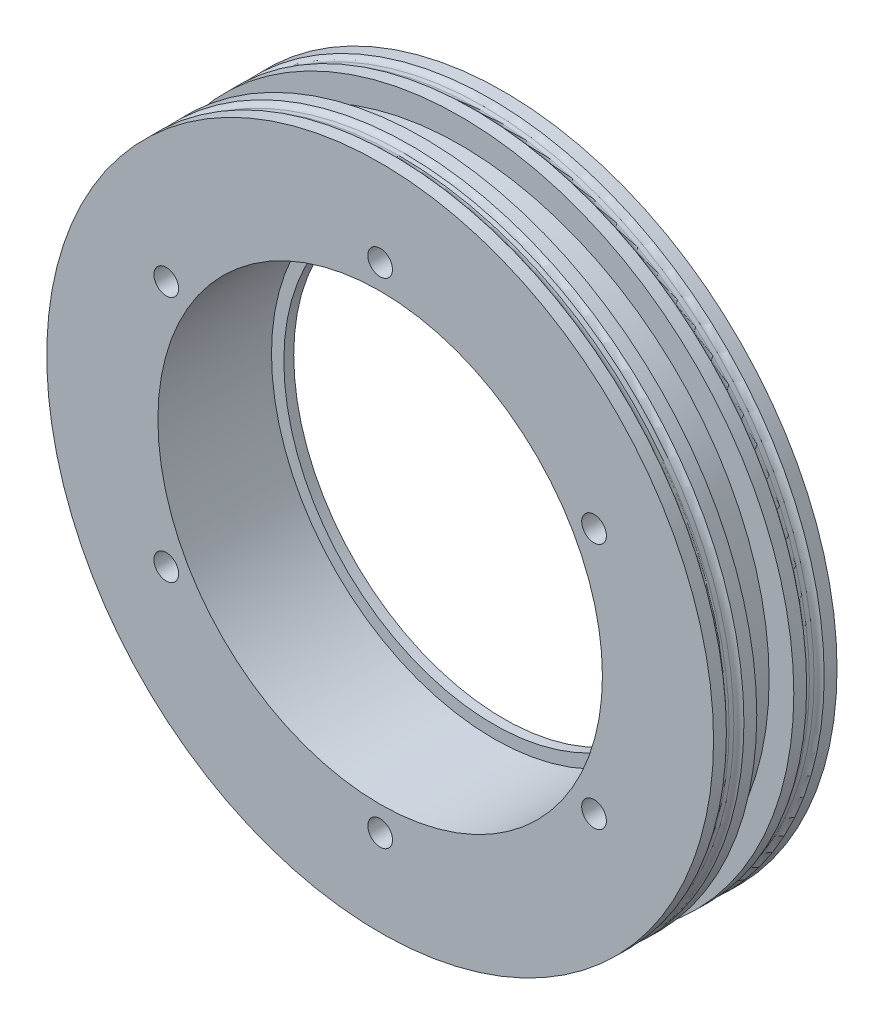
from build123d import *

# Parameters (mm, degrees)
CIRPATTERN1_COUNT = 6
SKETCH4_W         = 5
SKETCH4_H         = 7.5


with BuildPart() as part:
    # Sketch1 → Revolve1 (revolve)
    with BuildSketch(Plane(origin=(0, 0, 0), x_dir=(1, 0, 0), z_dir=(0, 1, 0))):
        Polygon((45, 0), (45, 23), (42.5, 23), (42.5, 25), (67.5, 25), (67.5, 0), align=None)
    revolve(axis=Axis((0, 0, 0), (0, 0, -1)))

    # Sketch3 → M6 Tapped Hole1 (revolve, cut)
    with BuildSketch(Plane(origin=(0, 50, 0), x_dir=(0, -1, 0), z_dir=(1, 0, 0))):
        Polygon((0, 0), (0, 16.502151548), (2.5, 15), (2.5, 0), align=None)
    m6_tapped_hole1 = revolve(axis=Axis((0, 50, 6.35), (0, 0, -1)), mode=Mode.SUBTRACT)

    # CirPattern1: M6 Tapped Hole1 ×6 about axis
    cirpattern1_axis = Axis((0, 0, 0), (0, 0, 1))
    for i in range(1, CIRPATTERN1_COUNT):
        add(m6_tapped_hole1.rotate(cirpattern1_axis, i * 360 / CIRPATTERN1_COUNT), mode=Mode.SUBTRACT)

    # Sketch4 → Cut-Revolve1 (revolve, cut)
    with BuildSketch(Plane(origin=(0, 0, 0), x_dir=(1, 0, 0), z_dir=(0, 1, 0))):
        with Locations((65, 12.5)):
            Rectangle(SKETCH4_W, SKETCH4_H)
    revolve(axis=Axis((0, 0, 0), (0, 0, -1)), mode=Mode.SUBTRACT)

    # Sketch5 → Cut-Revolve2 (revolve, cut)
    with BuildSketch(Plane(origin=(0, 0, 0), x_dir=(1, 0, 0), z_dir=(0, 1, 0))):
        with BuildLine():
            Line((67.5, 22.4), (67.5, 18.85))
            ThreePointArc((67.5, 18.85), (66.950961894, 19.399038106), (66.75, 20.149038106))
            Line((66.75, 20.149038106), (66.75, 21.100961894))
            ThreePointArc((66.75, 21.100961894), (66.950961894, 21.850961894), (67.5, 22.4))
        make_face()
    cut_revolve2 = revolve(axis=Axis((0, 0, 0), (0, 0, -1)), mode=Mode.SUBTRACT)

    # Mirror1: Cut-Revolve2 across plane
    add(cut_revolve2.mirror(Plane.XY.offset(-12.5)), mode=Mode.SUBTRACT)


solid = part.part
